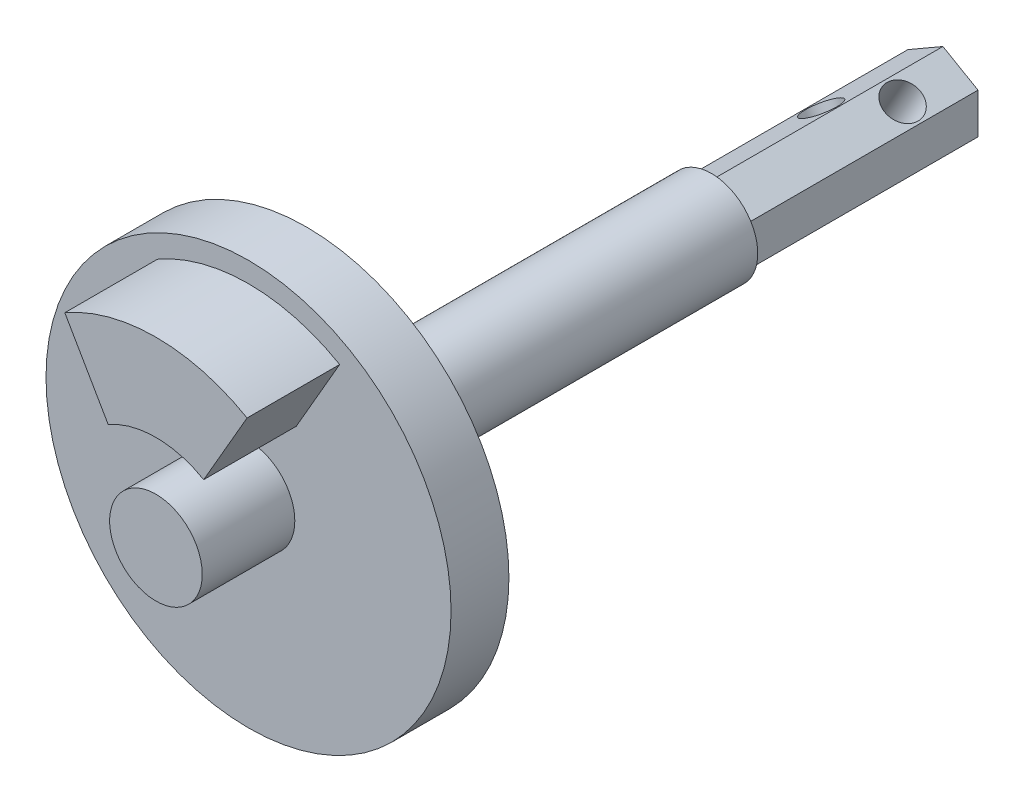
from build123d import *

# Parameters (mm, degrees)
SKETCH1_R           = 17.5
BOSS_EXTRUDE1_DEPTH = 2.5
BOSS_EXTRUDE2_DEPTH = 8
SKETCH3_R           = 4
BOSS_EXTRUDE3_DEPTH = 8
BOSS_EXTRUDE4_START = 35
SKETCH7_R           = 4
BOSS_EXTRUDE4_DEPTH = 35
BOSS_EXTRUDE5_DEPTH = 20
SKETCH10_R          = 1.55
CUT_EXTRUDE1_DEPTH  = 6.1
SKETCH11_R          = 1.55
CUT_EXTRUDE4_DEPTH  = 6.1


with BuildPart() as part:
    # Sketch1 → Boss-Extrude1 (new, symmetric)
    with BuildSketch(Plane.XY):
        Circle(SKETCH1_R)
    extrude(amount=BOSS_EXTRUDE1_DEPTH, both=True)

    # Sketch2 → Boss-Extrude2 (add)
    with BuildSketch(Plane.XY.offset(2.5)):
        with BuildLine():
            Line((7.875, 13.63990011), (4.125, 7.144709581))
            ThreePointArc((4.125, 7.144709581), (0, 8.25), (-4.125, 7.144709581))
            Line((-4.125, 7.144709581), (-7.875, 13.63990011))
            ThreePointArc((-7.875, 13.63990011), (0, 15.75), (7.875, 13.63990011))
        make_face()
    extrude(amount=BOSS_EXTRUDE2_DEPTH)

    # Sketch3 → Boss-Extrude3 (add)
    with BuildSketch(Plane.XY.offset(2.5)):
        Circle(SKETCH3_R)
    extrude(amount=BOSS_EXTRUDE3_DEPTH)

    # Sketch7 → Boss-Extrude4 (add)
    with BuildSketch(Plane(origin=(0, 0, -2.5), x_dir=(-1, 0, 0), z_dir=(0, 0, -1)).offset(BOSS_EXTRUDE4_START)):
        Circle(SKETCH7_R)
    extrude(amount=-BOSS_EXTRUDE4_DEPTH)

    # Sketch9 → Boss-Extrude5 (add)
    with BuildSketch(Plane(origin=(0, 0, -37.5), x_dir=(-1, 0, 0), z_dir=(0, 0, -1))):
        Polygon((0, 3.5), (-3.031088913, 1.75), (-3.031088913, -1.75), (0, -3.5), (3.031088913, -1.75), (3.031088913, 1.75), align=None)
    extrude(amount=BOSS_EXTRUDE5_DEPTH)

    # Sketch10 → Cut-Extrude1 (cut)
    with BuildSketch(Plane(origin=(-1.515544457, -2.625, 0), x_dir=(0.866025403784435, -0.5000000000000062, 0), z_dir=(-0.5000000000000062, -0.866025403784435, 0))):
        with Locations((0, -52.5)):
            Circle(SKETCH10_R)
    extrude(amount=-CUT_EXTRUDE1_DEPTH, mode=Mode.SUBTRACT)

    # Sketch11 → Cut-Extrude4 (cut)
    with BuildSketch(Plane(origin=(1.515544457, -2.625, 0), x_dir=(0, 0, 1), z_dir=(-0.49999999999999717, 0.8660254037844404, 0))):
        with Locations((-48.5, 0)):
            Circle(SKETCH11_R)
    extrude(amount=CUT_EXTRUDE4_DEPTH, mode=Mode.SUBTRACT)


solid = part.part
